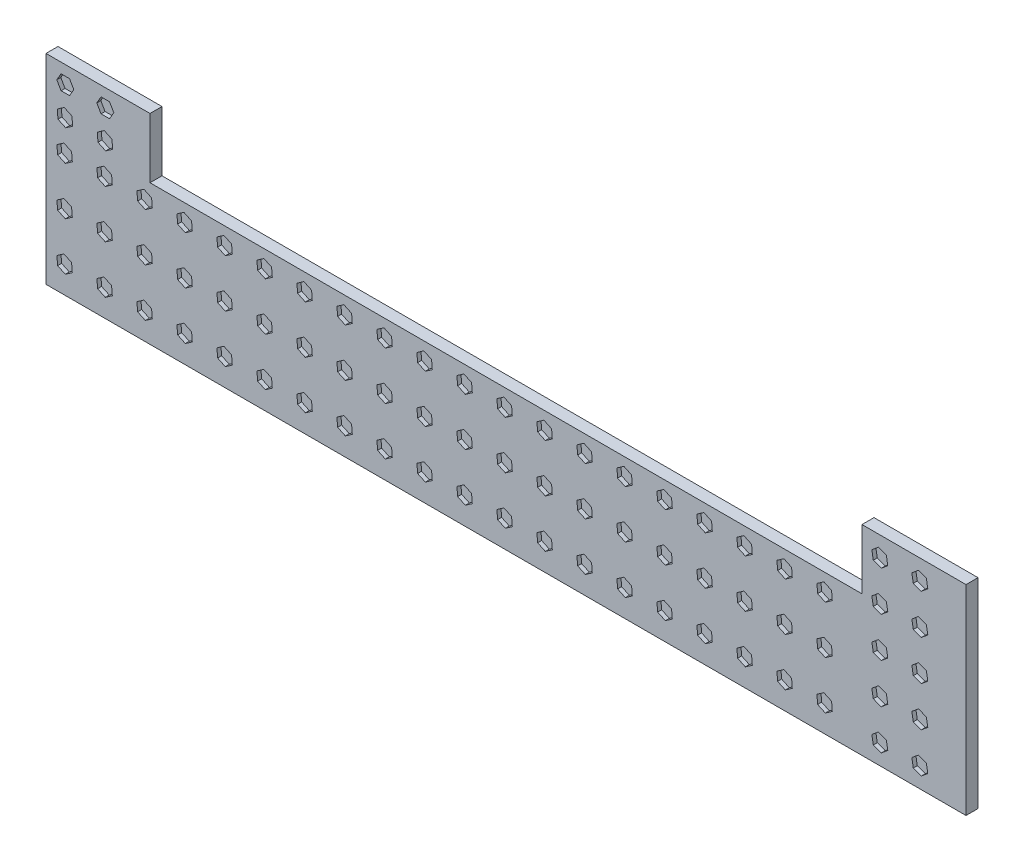
from build123d import *

# Parameters (mm, degrees)
BOSS_EXTRUDE1_DEPTH = 3
CUT_EXTRUDE1_DEPTH  = 1
CUT_EXTRUDE6_DEPTH  = 1


with BuildPart() as part:
    # Sketch1 → Boss-Extrude1 (new body)
    with BuildSketch(Plane.XY):
        Polygon((-151.295681063, 20.886468234), (-151.295681063, -29.113531766), (78.704318937, -29.113531766), (78.704318937, 20.886468234), (52.704318937, 20.886468234), (52.704318937, 5.886468234), (-125.295681063, 5.886468234), (-125.295681063, 20.886468234), align=None)
    extrude(amount=BOSS_EXTRUDE1_DEPTH)

    # Sketch2 → Cut-Extrude1 (cut)
    with BuildSketch(Plane.XY.offset(3)):
        Polygon((69.151922638, 15.196719151), (68.790531405, 17.290407215), (66.796648737, 18.024277258), (65.164157303, 16.664459237), (65.525548536, 14.570771173), (67.519431204, 13.83690113), align=None)
        Polygon((-144.347288547, 16.525071206), (-145.409613043, 18.365071206), (-147.534262033, 18.365071206), (-148.596586528, 16.525071206), (-147.534262033, 14.685071206), (-145.409613043, 14.685071206), align=None)
        Polygon((59.151922638, 15.196719151), (58.790531405, 17.290407215), (56.796648737, 18.024277258), (55.164157303, 16.664459237), (55.525548536, 14.570771173), (57.519431204, 13.83690113), align=None)
        Polygon((-144.635289855, 8.44585682), (-144.813034379, 10.563057854), (-146.735456522, 11.467727097), (-148.48013414, 10.255195307), (-148.302389615, 8.137994273), (-146.379967473, 7.23332503), align=None)
        Polygon((69.151922638, 5.196719151), (68.790531405, 7.290407215), (66.796648737, 8.024277258), (65.164157303, 6.664459237), (65.525548536, 4.570771173), (67.519431204, 3.83690113), align=None)
        Polygon((69.151922638, -4.803280849), (68.790531405, -2.709592785), (66.796648737, -1.975722742), (65.164157303, -3.335540763), (65.525548536, -5.429228827), (67.519431204, -6.16309887), align=None)
        Polygon((69.151922638, -14.803280849), (68.790531405, -12.709592785), (66.796648737, -11.975722742), (65.164157303, -13.335540763), (65.525548536, -15.429228827), (67.519431204, -16.16309887), align=None)
        Polygon((69.151922638, -24.803280849), (68.790531405, -22.709592785), (66.796648737, -21.975722742), (65.164157303, -23.335540763), (65.525548536, -25.429228827), (67.519431204, -26.16309887), align=None)
        Polygon((59.151922638, 5.196719151), (58.790531405, 7.290407215), (56.796648737, 8.024277258), (55.164157303, 6.664459237), (55.525548536, 4.570771173), (57.519431204, 3.83690113), align=None)
        Polygon((59.151922638, -4.803280849), (58.790531405, -2.709592785), (56.796648737, -1.975722742), (55.164157303, -3.335540763), (55.525548536, -5.429228827), (57.519431204, -6.16309887), align=None)
        Polygon((59.151922638, -14.803280849), (58.790531405, -12.709592785), (56.796648737, -11.975722742), (55.164157303, -13.335540763), (55.525548536, -15.429228827), (57.519431204, -16.16309887), align=None)
        Polygon((59.151922638, -24.803280849), (58.790531405, -22.709592785), (56.796648737, -21.975722742), (55.164157303, -23.335540763), (55.525548536, -25.429228827), (57.519431204, -26.16309887), align=None)
        Polygon((-144.72234614, 0.697847475), (-144.900090664, 2.815048509), (-146.822512806, 3.719717752), (-148.567190424, 2.507185962), (-148.3894459, 0.389984928), (-146.467023758, -0.514684315), align=None)
        Polygon((-134.347288547, 16.525071206), (-135.409613043, 18.365071206), (-137.534262033, 18.365071206), (-138.596586528, 16.525071206), (-137.534262033, 14.685071206), (-135.409613043, 14.685071206), align=None)
        Polygon((-134.635289855, 8.44585682), (-134.813034379, 10.563057854), (-136.735456522, 11.467727097), (-138.48013414, 10.255195307), (-138.302389615, 8.137994273), (-136.379967473, 7.23332503), align=None)
        Polygon((-134.72234614, 0.697847475), (-134.900090664, 2.815048509), (-136.822512806, 3.719717752), (-138.567190424, 2.507185962), (-138.3894459, 0.389984928), (-136.467023758, -0.514684315), align=None)
        Polygon((-124.72234614, 0.697847475), (-124.900090664, 2.815048509), (-126.822512806, 3.719717752), (-128.567190424, 2.507185962), (-128.3894459, 0.389984928), (-126.467023758, -0.514684315), align=None)
        Polygon((-114.72234614, 0.697847475), (-114.900090664, 2.815048509), (-116.822512806, 3.719717752), (-118.567190424, 2.507185962), (-118.3894459, 0.389984928), (-116.467023758, -0.514684315), align=None)
        Polygon((-104.72234614, 0.697847475), (-104.900090664, 2.815048509), (-106.822512806, 3.719717752), (-108.567190424, 2.507185962), (-108.3894459, 0.389984928), (-106.467023758, -0.514684315), align=None)
        Polygon((-94.72234614, 0.697847475), (-94.900090664, 2.815048509), (-96.822512806, 3.719717752), (-98.567190424, 2.507185962), (-98.3894459, 0.389984928), (-96.467023758, -0.514684315), align=None)
        Polygon((-84.72234614, 0.697847475), (-84.900090664, 2.815048509), (-86.822512806, 3.719717752), (-88.567190424, 2.507185962), (-88.3894459, 0.389984928), (-86.467023758, -0.514684315), align=None)
        Polygon((-74.72234614, 0.697847475), (-74.900090664, 2.815048509), (-76.822512806, 3.719717752), (-78.567190424, 2.507185962), (-78.3894459, 0.389984928), (-76.467023758, -0.514684315), align=None)
        Polygon((-64.72234614, 0.697847475), (-64.900090664, 2.815048509), (-66.822512806, 3.719717752), (-68.567190424, 2.507185962), (-68.3894459, 0.389984928), (-66.467023758, -0.514684315), align=None)
        Polygon((-54.72234614, 0.697847475), (-54.900090664, 2.815048509), (-56.822512806, 3.719717752), (-58.567190424, 2.507185962), (-58.3894459, 0.389984928), (-56.467023758, -0.514684315), align=None)
        Polygon((-44.72234614, 0.697847475), (-44.900090664, 2.815048509), (-46.822512806, 3.719717752), (-48.567190424, 2.507185962), (-48.3894459, 0.389984928), (-46.467023758, -0.514684315), align=None)
        Polygon((-34.72234614, 0.697847475), (-34.900090664, 2.815048509), (-36.822512806, 3.719717752), (-38.567190424, 2.507185962), (-38.3894459, 0.389984928), (-36.467023758, -0.514684315), align=None)
        Polygon((-24.72234614, 0.697847475), (-24.900090664, 2.815048509), (-26.822512806, 3.719717752), (-28.567190424, 2.507185962), (-28.3894459, 0.389984928), (-26.467023758, -0.514684315), align=None)
        Polygon((-14.72234614, 0.697847475), (-14.900090664, 2.815048509), (-16.822512806, 3.719717752), (-18.567190424, 2.507185962), (-18.3894459, 0.389984928), (-16.467023758, -0.514684315), align=None)
        Polygon((-4.72234614, 0.697847475), (-4.900090664, 2.815048509), (-6.822512806, 3.719717752), (-8.567190424, 2.507185962), (-8.3894459, 0.389984928), (-6.467023758, -0.514684315), align=None)
        Polygon((5.27765386, 0.697847475), (5.099909336, 2.815048509), (3.177487194, 3.719717752), (1.432809576, 2.507185962), (1.6105541, 0.389984928), (3.532976242, -0.514684315), align=None)
        Polygon((15.27765386, 0.697847475), (15.099909336, 2.815048509), (13.177487194, 3.719717752), (11.432809576, 2.507185962), (11.6105541, 0.389984928), (13.532976242, -0.514684315), align=None)
        Polygon((25.27765386, 0.697847475), (25.099909336, 2.815048509), (23.177487194, 3.719717752), (21.432809576, 2.507185962), (21.6105541, 0.389984928), (23.532976242, -0.514684315), align=None)
        Polygon((35.27765386, 0.697847475), (35.099909336, 2.815048509), (33.177487194, 3.719717752), (31.432809576, 2.507185962), (31.6105541, 0.389984928), (33.532976242, -0.514684315), align=None)
        Polygon((45.27765386, 0.697847475), (45.099909336, 2.815048509), (43.177487194, 3.719717752), (41.432809576, 2.507185962), (41.6105541, 0.389984928), (43.532976242, -0.514684315), align=None)
        Polygon((-134.72234614, -11.302152525), (-134.900090664, -9.184951491), (-136.822512806, -8.280282248), (-138.567190424, -9.492814038), (-138.3894459, -11.610015072), (-136.467023758, -12.514684315), align=None)
        Polygon((-124.72234614, -11.302152525), (-124.900090664, -9.184951491), (-126.822512806, -8.280282248), (-128.567190424, -9.492814038), (-128.3894459, -11.610015072), (-126.467023758, -12.514684315), align=None)
        Polygon((-114.72234614, -11.302152525), (-114.900090664, -9.184951491), (-116.822512806, -8.280282248), (-118.567190424, -9.492814038), (-118.3894459, -11.610015072), (-116.467023758, -12.514684315), align=None)
        Polygon((-104.72234614, -11.302152525), (-104.900090664, -9.184951491), (-106.822512806, -8.280282248), (-108.567190424, -9.492814038), (-108.3894459, -11.610015072), (-106.467023758, -12.514684315), align=None)
        Polygon((-94.72234614, -11.302152525), (-94.900090664, -9.184951491), (-96.822512806, -8.280282248), (-98.567190424, -9.492814038), (-98.3894459, -11.610015072), (-96.467023758, -12.514684315), align=None)
        Polygon((-84.72234614, -11.302152525), (-84.900090664, -9.184951491), (-86.822512806, -8.280282248), (-88.567190424, -9.492814038), (-88.3894459, -11.610015072), (-86.467023758, -12.514684315), align=None)
        Polygon((-74.72234614, -11.302152525), (-74.900090664, -9.184951491), (-76.822512806, -8.280282248), (-78.567190424, -9.492814038), (-78.3894459, -11.610015072), (-76.467023758, -12.514684315), align=None)
        Polygon((-64.72234614, -11.302152525), (-64.900090664, -9.184951491), (-66.822512806, -8.280282248), (-68.567190424, -9.492814038), (-68.3894459, -11.610015072), (-66.467023758, -12.514684315), align=None)
        Polygon((-54.72234614, -11.302152525), (-54.900090664, -9.184951491), (-56.822512806, -8.280282248), (-58.567190424, -9.492814038), (-58.3894459, -11.610015072), (-56.467023758, -12.514684315), align=None)
        Polygon((-44.72234614, -11.302152525), (-44.900090664, -9.184951491), (-46.822512806, -8.280282248), (-48.567190424, -9.492814038), (-48.3894459, -11.610015072), (-46.467023758, -12.514684315), align=None)
        Polygon((-34.72234614, -11.302152525), (-34.900090664, -9.184951491), (-36.822512806, -8.280282248), (-38.567190424, -9.492814038), (-38.3894459, -11.610015072), (-36.467023758, -12.514684315), align=None)
        Polygon((-24.72234614, -11.302152525), (-24.900090664, -9.184951491), (-26.822512806, -8.280282248), (-28.567190424, -9.492814038), (-28.3894459, -11.610015072), (-26.467023758, -12.514684315), align=None)
        Polygon((-14.72234614, -11.302152525), (-14.900090664, -9.184951491), (-16.822512806, -8.280282248), (-18.567190424, -9.492814038), (-18.3894459, -11.610015072), (-16.467023758, -12.514684315), align=None)
        Polygon((-4.72234614, -11.302152525), (-4.900090664, -9.184951491), (-6.822512806, -8.280282248), (-8.567190424, -9.492814038), (-8.3894459, -11.610015072), (-6.467023758, -12.514684315), align=None)
        Polygon((5.27765386, -11.302152525), (5.099909336, -9.184951491), (3.177487194, -8.280282248), (1.432809576, -9.492814038), (1.6105541, -11.610015072), (3.532976242, -12.514684315), align=None)
        Polygon((15.27765386, -11.302152525), (15.099909336, -9.184951491), (13.177487194, -8.280282248), (11.432809576, -9.492814038), (11.6105541, -11.610015072), (13.532976242, -12.514684315), align=None)
        Polygon((25.27765386, -11.302152525), (25.099909336, -9.184951491), (23.177487194, -8.280282248), (21.432809576, -9.492814038), (21.6105541, -11.610015072), (23.532976242, -12.514684315), align=None)
        Polygon((35.27765386, -11.302152525), (35.099909336, -9.184951491), (33.177487194, -8.280282248), (31.432809576, -9.492814038), (31.6105541, -11.610015072), (33.532976242, -12.514684315), align=None)
        Polygon((45.27765386, -11.302152525), (45.099909336, -9.184951491), (43.177487194, -8.280282248), (41.432809576, -9.492814038), (41.6105541, -11.610015072), (43.532976242, -12.514684315), align=None)
        Polygon((-134.72234614, -23.302152525), (-134.900090664, -21.184951491), (-136.822512806, -20.280282248), (-138.567190424, -21.492814038), (-138.3894459, -23.610015072), (-136.467023758, -24.514684315), align=None)
        Polygon((-124.72234614, -23.302152525), (-124.900090664, -21.184951491), (-126.822512806, -20.280282248), (-128.567190424, -21.492814038), (-128.3894459, -23.610015072), (-126.467023758, -24.514684315), align=None)
        Polygon((-114.72234614, -23.302152525), (-114.900090664, -21.184951491), (-116.822512806, -20.280282248), (-118.567190424, -21.492814038), (-118.3894459, -23.610015072), (-116.467023758, -24.514684315), align=None)
        Polygon((-104.72234614, -23.302152525), (-104.900090664, -21.184951491), (-106.822512806, -20.280282248), (-108.567190424, -21.492814038), (-108.3894459, -23.610015072), (-106.467023758, -24.514684315), align=None)
        Polygon((-94.72234614, -23.302152525), (-94.900090664, -21.184951491), (-96.822512806, -20.280282248), (-98.567190424, -21.492814038), (-98.3894459, -23.610015072), (-96.467023758, -24.514684315), align=None)
        Polygon((-84.72234614, -23.302152525), (-84.900090664, -21.184951491), (-86.822512806, -20.280282248), (-88.567190424, -21.492814038), (-88.3894459, -23.610015072), (-86.467023758, -24.514684315), align=None)
        Polygon((-74.72234614, -23.302152525), (-74.900090664, -21.184951491), (-76.822512806, -20.280282248), (-78.567190424, -21.492814038), (-78.3894459, -23.610015072), (-76.467023758, -24.514684315), align=None)
        Polygon((-64.72234614, -23.302152525), (-64.900090664, -21.184951491), (-66.822512806, -20.280282248), (-68.567190424, -21.492814038), (-68.3894459, -23.610015072), (-66.467023758, -24.514684315), align=None)
        Polygon((-54.72234614, -23.302152525), (-54.900090664, -21.184951491), (-56.822512806, -20.280282248), (-58.567190424, -21.492814038), (-58.3894459, -23.610015072), (-56.467023758, -24.514684315), align=None)
        Polygon((-44.72234614, -23.302152525), (-44.900090664, -21.184951491), (-46.822512806, -20.280282248), (-48.567190424, -21.492814038), (-48.3894459, -23.610015072), (-46.467023758, -24.514684315), align=None)
        Polygon((-34.72234614, -23.302152525), (-34.900090664, -21.184951491), (-36.822512806, -20.280282248), (-38.567190424, -21.492814038), (-38.3894459, -23.610015072), (-36.467023758, -24.514684315), align=None)
        Polygon((-24.72234614, -23.302152525), (-24.900090664, -21.184951491), (-26.822512806, -20.280282248), (-28.567190424, -21.492814038), (-28.3894459, -23.610015072), (-26.467023758, -24.514684315), align=None)
        Polygon((-14.72234614, -23.302152525), (-14.900090664, -21.184951491), (-16.822512806, -20.280282248), (-18.567190424, -21.492814038), (-18.3894459, -23.610015072), (-16.467023758, -24.514684315), align=None)
        Polygon((-4.72234614, -23.302152525), (-4.900090664, -21.184951491), (-6.822512806, -20.280282248), (-8.567190424, -21.492814038), (-8.3894459, -23.610015072), (-6.467023758, -24.514684315), align=None)
        Polygon((5.27765386, -23.302152525), (5.099909336, -21.184951491), (3.177487194, -20.280282248), (1.432809576, -21.492814038), (1.6105541, -23.610015072), (3.532976242, -24.514684315), align=None)
        Polygon((15.27765386, -23.302152525), (15.099909336, -21.184951491), (13.177487194, -20.280282248), (11.432809576, -21.492814038), (11.6105541, -23.610015072), (13.532976242, -24.514684315), align=None)
        Polygon((25.27765386, -23.302152525), (25.099909336, -21.184951491), (23.177487194, -20.280282248), (21.432809576, -21.492814038), (21.6105541, -23.610015072), (23.532976242, -24.514684315), align=None)
        Polygon((35.27765386, -23.302152525), (35.099909336, -21.184951491), (33.177487194, -20.280282248), (31.432809576, -21.492814038), (31.6105541, -23.610015072), (33.532976242, -24.514684315), align=None)
        Polygon((45.27765386, -23.302152525), (45.099909336, -21.184951491), (43.177487194, -20.280282248), (41.432809576, -21.492814038), (41.6105541, -23.610015072), (43.532976242, -24.514684315), align=None)
        Polygon((-144.72234614, -11.302152525), (-144.900090664, -9.184951491), (-146.822512806, -8.280282248), (-148.567190424, -9.492814038), (-148.3894459, -11.610015072), (-146.467023758, -12.514684315), align=None)
        Polygon((-144.72234614, -23.302152525), (-144.900090664, -21.184951491), (-146.822512806, -20.280282248), (-148.567190424, -21.492814038), (-148.3894459, -23.610015072), (-146.467023758, -24.514684315), align=None)
    extrude(amount=-CUT_EXTRUDE1_DEPTH, mode=Mode.SUBTRACT)

    # Sketch3 → Cut-Extrude6 (cut)
    with BuildSketch(Plane(origin=(0, 0, 0), x_dir=(-1, 0, 0), z_dir=(0, 0, -1))):
        Polygon((133.460024328, 15.015955656), (133.964393346, 17.07987068), (132.429175013, 18.548624575), (130.389587662, 17.953463446), (129.885218643, 15.889548422), (131.420436976, 14.420794527), align=None)
        Polygon((-69.750917416, 15.451772151), (-70.002536187, 17.561469126), (-71.955396747, 18.398409367), (-73.656638537, 17.125652631), (-73.405019766, 15.015955656), (-71.452159206, 14.179015416), align=None)
        Polygon((-69.679400221, 4.539601989), (-69.684824077, 6.664244056), (-71.527530009, 7.721867893), (-73.364812085, 6.654849663), (-73.35938823, 4.530207595), (-71.516682298, 3.472583758), align=None)
        Polygon((-69.477205841, -5.89496498), (-68.972836823, -3.831049955), (-70.508055156, -2.362296061), (-72.547642507, -2.95745719), (-73.052011525, -5.021372214), (-71.516793193, -6.490126109), align=None)
        Polygon((134.795292483, 6.009167057), (133.732967988, 7.849167057), (131.608318997, 7.849167057), (130.545994502, 6.009167057), (131.608318997, 4.169167057), (133.732967988, 4.169167057), align=None)
        Polygon((-59.750917416, 15.451772151), (-60.002536187, 17.561469126), (-61.955396747, 18.398409367), (-63.656638537, 17.125652631), (-63.405019766, 15.015955656), (-61.452159206, 14.179015416), align=None)
        Polygon((-59.679400221, 4.539601989), (-59.684824077, 6.664244056), (-61.527530009, 7.721867893), (-63.364812085, 6.654849663), (-63.35938823, 4.530207595), (-61.516682298, 3.472583758), align=None)
        Polygon((143.460024328, 15.015955656), (143.964393346, 17.07987068), (142.429175013, 18.548624575), (140.389587662, 17.953463446), (139.885218643, 15.889548422), (141.420436976, 14.420794527), align=None)
        Polygon((144.795292483, 6.009167057), (143.732967988, 7.849167057), (141.608318997, 7.849167057), (140.545994502, 6.009167057), (141.608318997, 4.169167057), (143.732967988, 4.169167057), align=None)
        Polygon((144.795292483, -3.990832943), (143.732967988, -2.150832943), (141.608318997, -2.150832943), (140.545994502, -3.990832943), (141.608318997, -5.830832943), (143.732967988, -5.830832943), align=None)
        Polygon((144.795292483, -13.990832943), (143.732967988, -12.150832943), (141.608318997, -12.150832943), (140.545994502, -13.990832943), (141.608318997, -15.830832943), (143.732967988, -15.830832943), align=None)
        Polygon((144.795292483, -23.990832943), (143.732967988, -22.150832943), (141.608318997, -22.150832943), (140.545994502, -23.990832943), (141.608318997, -25.830832943), (143.732967988, -25.830832943), align=None)
        Polygon((134.795292483, -3.990832943), (133.732967988, -2.150832943), (131.608318997, -2.150832943), (130.545994502, -3.990832943), (131.608318997, -5.830832943), (133.732967988, -5.830832943), align=None)
        Polygon((134.795292483, -13.990832943), (133.732967988, -12.150832943), (131.608318997, -12.150832943), (130.545994502, -13.990832943), (131.608318997, -15.830832943), (133.732967988, -15.830832943), align=None)
        Polygon((134.795292483, -23.990832943), (133.732967988, -22.150832943), (131.608318997, -22.150832943), (130.545994502, -23.990832943), (131.608318997, -25.830832943), (133.732967988, -25.830832943), align=None)
        Polygon((-59.477205841, -5.89496498), (-58.972836823, -3.831049955), (-60.508055156, -2.362296061), (-62.547642507, -2.95745719), (-63.052011525, -5.021372214), (-61.516793193, -6.490126109), align=None)
        Polygon((-49.477205841, -5.89496498), (-48.972836823, -3.831049955), (-50.508055156, -2.362296061), (-52.547642507, -2.95745719), (-53.052011525, -5.021372214), (-51.516793193, -6.490126109), align=None)
        Polygon((-39.477205841, -5.89496498), (-38.972836823, -3.831049955), (-40.508055156, -2.362296061), (-42.547642507, -2.95745719), (-43.052011525, -5.021372214), (-41.516793193, -6.490126109), align=None)
        Polygon((-29.477205841, -5.89496498), (-28.972836823, -3.831049955), (-30.508055156, -2.362296061), (-32.547642507, -2.95745719), (-33.052011525, -5.021372214), (-31.516793193, -6.490126109), align=None)
        Polygon((-19.477205841, -5.89496498), (-18.972836823, -3.831049955), (-20.508055156, -2.362296061), (-22.547642507, -2.95745719), (-23.052011525, -5.021372214), (-21.516793193, -6.490126109), align=None)
        Polygon((-9.477205841, -5.89496498), (-8.972836823, -3.831049955), (-10.508055156, -2.362296061), (-12.547642507, -2.95745719), (-13.052011525, -5.021372214), (-11.516793193, -6.490126109), align=None)
        Polygon((0.522794159, -5.89496498), (1.027163177, -3.831049955), (-0.508055156, -2.362296061), (-2.547642507, -2.95745719), (-3.052011525, -5.021372214), (-1.516793193, -6.490126109), align=None)
        Polygon((10.522794159, -5.89496498), (11.027163177, -3.831049955), (9.491944844, -2.362296061), (7.452357493, -2.95745719), (6.947988475, -5.021372214), (8.483206807, -6.490126109), align=None)
        Polygon((20.522794159, -5.89496498), (21.027163177, -3.831049955), (19.491944844, -2.362296061), (17.452357493, -2.95745719), (16.947988475, -5.021372214), (18.483206807, -6.490126109), align=None)
        Polygon((30.522794159, -5.89496498), (31.027163177, -3.831049955), (29.491944844, -2.362296061), (27.452357493, -2.95745719), (26.947988475, -5.021372214), (28.483206807, -6.490126109), align=None)
        Polygon((40.522794159, -5.89496498), (41.027163177, -3.831049955), (39.491944844, -2.362296061), (37.452357493, -2.95745719), (36.947988475, -5.021372214), (38.483206807, -6.490126109), align=None)
        Polygon((50.522794159, -5.89496498), (51.027163177, -3.831049955), (49.491944844, -2.362296061), (47.452357493, -2.95745719), (46.947988475, -5.021372214), (48.483206807, -6.490126109), align=None)
        Polygon((60.522794159, -5.89496498), (61.027163177, -3.831049955), (59.491944844, -2.362296061), (57.452357493, -2.95745719), (56.947988475, -5.021372214), (58.483206807, -6.490126109), align=None)
        Polygon((70.522794159, -5.89496498), (71.027163177, -3.831049955), (69.491944844, -2.362296061), (67.452357493, -2.95745719), (66.947988475, -5.021372214), (68.483206807, -6.490126109), align=None)
        Polygon((80.522794159, -5.89496498), (81.027163177, -3.831049955), (79.491944844, -2.362296061), (77.452357493, -2.95745719), (76.947988475, -5.021372214), (78.483206807, -6.490126109), align=None)
        Polygon((90.522794159, -5.89496498), (91.027163177, -3.831049955), (89.491944844, -2.362296061), (87.452357493, -2.95745719), (86.947988475, -5.021372214), (88.483206807, -6.490126109), align=None)
        Polygon((100.522794159, -5.89496498), (101.027163177, -3.831049955), (99.491944844, -2.362296061), (97.452357493, -2.95745719), (96.947988475, -5.021372214), (98.483206807, -6.490126109), align=None)
        Polygon((110.522794159, -5.89496498), (111.027163177, -3.831049955), (109.491944844, -2.362296061), (107.452357493, -2.95745719), (106.947988475, -5.021372214), (108.483206807, -6.490126109), align=None)
        Polygon((120.522794159, -5.89496498), (121.027163177, -3.831049955), (119.491944844, -2.362296061), (117.452357493, -2.95745719), (116.947988475, -5.021372214), (118.483206807, -6.490126109), align=None)
        Polygon((-59.477205841, -15.89496498), (-58.972836823, -13.831049955), (-60.508055156, -12.362296061), (-62.547642507, -12.95745719), (-63.052011525, -15.021372214), (-61.516793193, -16.490126109), align=None)
        Polygon((-49.477205841, -15.89496498), (-48.972836823, -13.831049955), (-50.508055156, -12.362296061), (-52.547642507, -12.95745719), (-53.052011525, -15.021372214), (-51.516793193, -16.490126109), align=None)
        Polygon((-39.477205841, -15.89496498), (-38.972836823, -13.831049955), (-40.508055156, -12.362296061), (-42.547642507, -12.95745719), (-43.052011525, -15.021372214), (-41.516793193, -16.490126109), align=None)
        Polygon((-29.477205841, -15.89496498), (-28.972836823, -13.831049955), (-30.508055156, -12.362296061), (-32.547642507, -12.95745719), (-33.052011525, -15.021372214), (-31.516793193, -16.490126109), align=None)
        Polygon((-19.477205841, -15.89496498), (-18.972836823, -13.831049955), (-20.508055156, -12.362296061), (-22.547642507, -12.95745719), (-23.052011525, -15.021372214), (-21.516793193, -16.490126109), align=None)
        Polygon((-9.477205841, -15.89496498), (-8.972836823, -13.831049955), (-10.508055156, -12.362296061), (-12.547642507, -12.95745719), (-13.052011525, -15.021372214), (-11.516793193, -16.490126109), align=None)
        Polygon((0.522794159, -15.89496498), (1.027163177, -13.831049955), (-0.508055156, -12.362296061), (-2.547642507, -12.95745719), (-3.052011525, -15.021372214), (-1.516793193, -16.490126109), align=None)
        Polygon((10.522794159, -15.89496498), (11.027163177, -13.831049955), (9.491944844, -12.362296061), (7.452357493, -12.95745719), (6.947988475, -15.021372214), (8.483206807, -16.490126109), align=None)
        Polygon((20.522794159, -15.89496498), (21.027163177, -13.831049955), (19.491944844, -12.362296061), (17.452357493, -12.95745719), (16.947988475, -15.021372214), (18.483206807, -16.490126109), align=None)
        Polygon((30.522794159, -15.89496498), (31.027163177, -13.831049955), (29.491944844, -12.362296061), (27.452357493, -12.95745719), (26.947988475, -15.021372214), (28.483206807, -16.490126109), align=None)
        Polygon((40.522794159, -15.89496498), (41.027163177, -13.831049955), (39.491944844, -12.362296061), (37.452357493, -12.95745719), (36.947988475, -15.021372214), (38.483206807, -16.490126109), align=None)
        Polygon((50.522794159, -15.89496498), (51.027163177, -13.831049955), (49.491944844, -12.362296061), (47.452357493, -12.95745719), (46.947988475, -15.021372214), (48.483206807, -16.490126109), align=None)
        Polygon((60.522794159, -15.89496498), (61.027163177, -13.831049955), (59.491944844, -12.362296061), (57.452357493, -12.95745719), (56.947988475, -15.021372214), (58.483206807, -16.490126109), align=None)
        Polygon((70.522794159, -15.89496498), (71.027163177, -13.831049955), (69.491944844, -12.362296061), (67.452357493, -12.95745719), (66.947988475, -15.021372214), (68.483206807, -16.490126109), align=None)
        Polygon((80.522794159, -15.89496498), (81.027163177, -13.831049955), (79.491944844, -12.362296061), (77.452357493, -12.95745719), (76.947988475, -15.021372214), (78.483206807, -16.490126109), align=None)
        Polygon((90.522794159, -15.89496498), (91.027163177, -13.831049955), (89.491944844, -12.362296061), (87.452357493, -12.95745719), (86.947988475, -15.021372214), (88.483206807, -16.490126109), align=None)
        Polygon((100.522794159, -15.89496498), (101.027163177, -13.831049955), (99.491944844, -12.362296061), (97.452357493, -12.95745719), (96.947988475, -15.021372214), (98.483206807, -16.490126109), align=None)
        Polygon((110.522794159, -15.89496498), (111.027163177, -13.831049955), (109.491944844, -12.362296061), (107.452357493, -12.95745719), (106.947988475, -15.021372214), (108.483206807, -16.490126109), align=None)
        Polygon((120.522794159, -15.89496498), (121.027163177, -13.831049955), (119.491944844, -12.362296061), (117.452357493, -12.95745719), (116.947988475, -15.021372214), (118.483206807, -16.490126109), align=None)
        Polygon((-59.477205841, -25.89496498), (-58.972836823, -23.831049955), (-60.508055156, -22.362296061), (-62.547642507, -22.95745719), (-63.052011525, -25.021372214), (-61.516793193, -26.490126109), align=None)
        Polygon((-49.477205841, -25.89496498), (-48.972836823, -23.831049955), (-50.508055156, -22.362296061), (-52.547642507, -22.95745719), (-53.052011525, -25.021372214), (-51.516793193, -26.490126109), align=None)
        Polygon((-39.477205841, -25.89496498), (-38.972836823, -23.831049955), (-40.508055156, -22.362296061), (-42.547642507, -22.95745719), (-43.052011525, -25.021372214), (-41.516793193, -26.490126109), align=None)
        Polygon((-29.477205841, -25.89496498), (-28.972836823, -23.831049955), (-30.508055156, -22.362296061), (-32.547642507, -22.95745719), (-33.052011525, -25.021372214), (-31.516793193, -26.490126109), align=None)
        Polygon((-19.477205841, -25.89496498), (-18.972836823, -23.831049955), (-20.508055156, -22.362296061), (-22.547642507, -22.95745719), (-23.052011525, -25.021372214), (-21.516793193, -26.490126109), align=None)
        Polygon((-9.477205841, -25.89496498), (-8.972836823, -23.831049955), (-10.508055156, -22.362296061), (-12.547642507, -22.95745719), (-13.052011525, -25.021372214), (-11.516793193, -26.490126109), align=None)
        Polygon((0.522794159, -25.89496498), (1.027163177, -23.831049955), (-0.508055156, -22.362296061), (-2.547642507, -22.95745719), (-3.052011525, -25.021372214), (-1.516793193, -26.490126109), align=None)
        Polygon((10.522794159, -25.89496498), (11.027163177, -23.831049955), (9.491944844, -22.362296061), (7.452357493, -22.95745719), (6.947988475, -25.021372214), (8.483206807, -26.490126109), align=None)
        Polygon((20.522794159, -25.89496498), (21.027163177, -23.831049955), (19.491944844, -22.362296061), (17.452357493, -22.95745719), (16.947988475, -25.021372214), (18.483206807, -26.490126109), align=None)
        Polygon((30.522794159, -25.89496498), (31.027163177, -23.831049955), (29.491944844, -22.362296061), (27.452357493, -22.95745719), (26.947988475, -25.021372214), (28.483206807, -26.490126109), align=None)
        Polygon((40.522794159, -25.89496498), (41.027163177, -23.831049955), (39.491944844, -22.362296061), (37.452357493, -22.95745719), (36.947988475, -25.021372214), (38.483206807, -26.490126109), align=None)
        Polygon((50.522794159, -25.89496498), (51.027163177, -23.831049955), (49.491944844, -22.362296061), (47.452357493, -22.95745719), (46.947988475, -25.021372214), (48.483206807, -26.490126109), align=None)
        Polygon((60.522794159, -25.89496498), (61.027163177, -23.831049955), (59.491944844, -22.362296061), (57.452357493, -22.95745719), (56.947988475, -25.021372214), (58.483206807, -26.490126109), align=None)
        Polygon((70.522794159, -25.89496498), (71.027163177, -23.831049955), (69.491944844, -22.362296061), (67.452357493, -22.95745719), (66.947988475, -25.021372214), (68.483206807, -26.490126109), align=None)
        Polygon((80.522794159, -25.89496498), (81.027163177, -23.831049955), (79.491944844, -22.362296061), (77.452357493, -22.95745719), (76.947988475, -25.021372214), (78.483206807, -26.490126109), align=None)
        Polygon((90.522794159, -25.89496498), (91.027163177, -23.831049955), (89.491944844, -22.362296061), (87.452357493, -22.95745719), (86.947988475, -25.021372214), (88.483206807, -26.490126109), align=None)
        Polygon((100.522794159, -25.89496498), (101.027163177, -23.831049955), (99.491944844, -22.362296061), (97.452357493, -22.95745719), (96.947988475, -25.021372214), (98.483206807, -26.490126109), align=None)
        Polygon((110.522794159, -25.89496498), (111.027163177, -23.831049955), (109.491944844, -22.362296061), (107.452357493, -22.95745719), (106.947988475, -25.021372214), (108.483206807, -26.490126109), align=None)
        Polygon((120.522794159, -25.89496498), (121.027163177, -23.831049955), (119.491944844, -22.362296061), (117.452357493, -22.95745719), (116.947988475, -25.021372214), (118.483206807, -26.490126109), align=None)
        Polygon((-69.477205841, -15.89496498), (-68.972836823, -13.831049955), (-70.508055156, -12.362296061), (-72.547642507, -12.95745719), (-73.052011525, -15.021372214), (-71.516793193, -16.490126109), align=None)
        Polygon((-69.477205841, -25.89496498), (-68.972836823, -23.831049955), (-70.508055156, -22.362296061), (-72.547642507, -22.95745719), (-73.052011525, -25.021372214), (-71.516793193, -26.490126109), align=None)
    extrude(amount=-CUT_EXTRUDE6_DEPTH, mode=Mode.SUBTRACT)


solid = part.part
